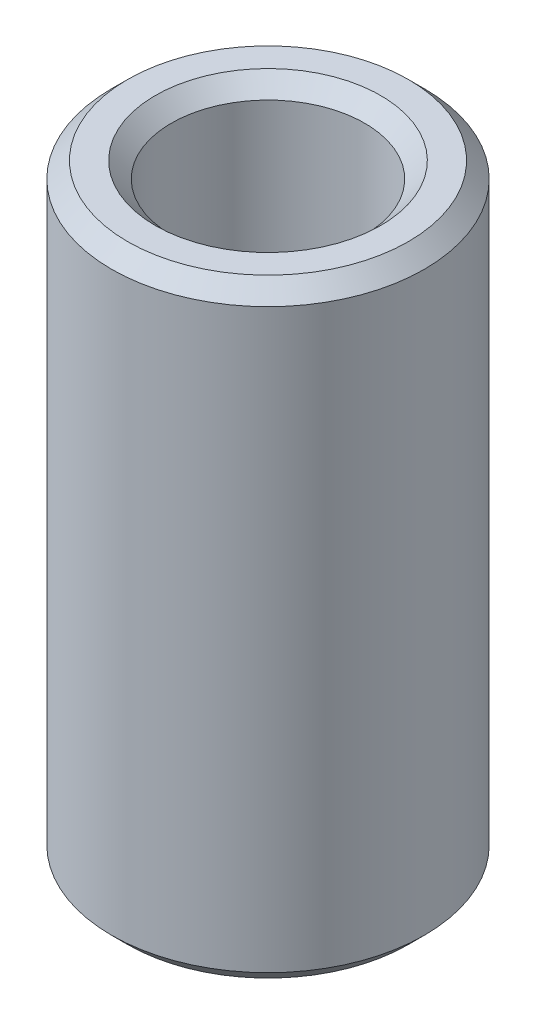
from build123d import *

# Parameters (mm, degrees)
SKETCH1_R           = 37.5
BOSS_EXTRUDE1_DEPTH = 145.956649866
SKETCH2_R           = 23.186886338
CUT_EXTRUDE1_DEPTH  = 156.292767507
CHAMFER1_SIZE       = 3.831536539


with BuildPart() as part:
    # Sketch1 → Boss-Extrude1 (new body)
    with BuildSketch(Plane(origin=(0, 0, 0), x_dir=(1, 0, 0), z_dir=(0, 1, 0))):
        Circle(SKETCH1_R)
    extrude(amount=BOSS_EXTRUDE1_DEPTH)

    # Sketch2 → Cut-Extrude1 (cut, through all)
    with BuildSketch(Plane(origin=(0, 0, 0), x_dir=(1, 0, 0), z_dir=(0, 1, 0))):
        Circle(SKETCH2_R)
    extrude(amount=CUT_EXTRUDE1_DEPTH, mode=Mode.SUBTRACT)

    # Chamfer1
    chamfer1_edges = [part.edges().sort_by_distance(p)[0] for p in [
        (-23.186886338, 145.956649866, 0),
        (-23.186886338, 0, 0),
        (-37.5, 0, 0),
        (-37.5, 145.956649866, 0),
    ]]
    chamfer(chamfer1_edges, length=CHAMFER1_SIZE)


solid = part.part
